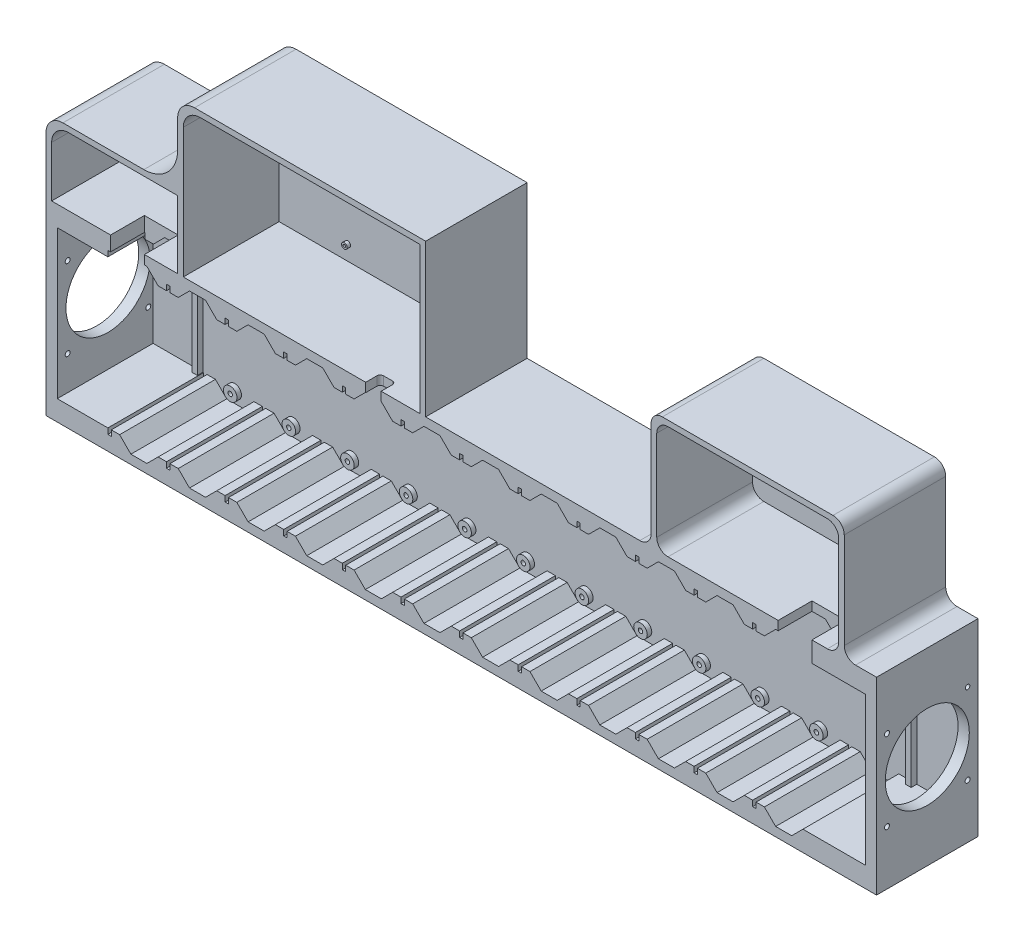
from build123d import *

# Parameters (mm, degrees)
SZKIC1_R                       = 6
DODANIE_WYCI_GNI_CIE1_DEPTH    = 4
DODANIE_WYCI_GNI_CIE1_2_DEPTH  = 4
DODANIE_WYCI_GNI_CIE1_3_DEPTH  = 4
DODANIE_WYCI_GNI_CIE1_4_DEPTH  = 4
DODANIE_WYCI_GNI_CIE1_5_DEPTH  = 4
DODANIE_WYCI_GNI_CIE1_6_DEPTH  = 4
DODANIE_WYCI_GNI_CIE1_7_DEPTH  = 4
DODANIE_WYCI_GNI_CIE1_8_DEPTH  = 4
DODANIE_WYCI_GNI_CIE1_9_DEPTH  = 4
DODANIE_WYCI_GNI_CIE1_10_DEPTH = 4
DODANIE_WYCI_GNI_CIE1_11_DEPTH = 4
DODANIE_WYCI_GNI_CIE1_12_DEPTH = 4
DODANIE_WYCI_GNI_CIE1_13_DEPTH = 4
DODANIE_WYCI_GNI_CIE1_14_DEPTH = 4
DODANIE_WYCI_GNI_CIE1_15_DEPTH = 4
DODANIE_WYCI_GNI_CIE1_16_DEPTH = 4
DODANIE_WYCI_GNI_CIE1_17_DEPTH = 4
DODANIE_WYCI_GNI_CIE1_18_DEPTH = 4
DODANIE_WYCI_GNI_CIE1_19_DEPTH = 4
DODANIE_WYCI_GNI_CIE1_20_DEPTH = 4
DODANIE_WYCI_GNI_CIE1_21_DEPTH = 4
SZKIC1_R_2                     = 2
DODANIE_WYCI_GNI_CIE1_22_DEPTH = 4
DODANIE_WYCI_GNI_CIE1_23_DEPTH = 4
DODANIE_WYCI_GNI_CIE1_24_DEPTH = 4
DODANIE_WYCI_GNI_CIE2_START    = -5
SZKIC1_3_R                     = 6
DODANIE_WYCI_GNI_CIE2_DEPTH    = 5
DODANIE_WYCI_GNI_CIE3_START    = -5
SZKIC1_4_W                     = 736.8
SZKIC1_4_H                     = 167.4
DODANIE_WYCI_GNI_CIE3_DEPTH    = 90
SZKIC2_W                       = 736.8
SZKIC2_H                       = 167.4
DODANIE_WYCI_GNI_CIE4_DEPTH    = 5
WYTNIJ_WYCI_GNI_CIE1_START     = -4
SZKIC3_R                       = 2
WYTNIJ_WYCI_GNI_CIE1_DEPTH     = 4
SZKIC4_W                       = 45
SZKIC4_H                       = 131.4
WYTNIJ_WYCI_GNI_CIE2_DEPTH     = 85
SZKIC5_W                       = 5
SZKIC5_H                       = 131.4
DODANIE_WYCI_GNI_CIE5_DEPTH    = 5
SZKIC7_R                       = 2
SZKIC7_R_2                     = 2.2
SZKIC7_R_3                     = 37.294131406
WYTNIJ_WYCI_GNI_CIE5_DEPTH     = 15
WYTNIJ_WYCI_GNI_CIE7_START     = -700
SZKIC7_3_R                     = 2
SZKIC7_3_R_2                   = 2.2
SZKIC7_3_R_3                   = 37.294131406
WYTNIJ_WYCI_GNI_CIE7_DEPTH     = 5000
SZKIC8_W                       = 30
SZKIC8_H                       = 30
WYTNIJ_WYCI_GNI_CIE8_DEPTH     = 40
DODANIE_WYCI_GNI_CIE6_DEPTH    = 100
SZKIC11_W                      = 171.35
SZKIC11_H                      = 90
DODANIE_WYCI_GNI_CIE7_DEPTH    = 5
SZKIC10_R                      = 2.6543
DODANIE_WYCI_GNI_CIE8_DEPTH    = 5
ZAOKR_GLENIE1_R                = 10
DODANIE_WYCI_GNI_CIE9_DEPTH    = 130
SZKIC13_R                      = 2.5
SZKIC13_R_2                    = 1.1
DODANIE_WYCI_GNI_CIE10_DEPTH   = 3
SZKIC15_W                      = 3
SZKIC15_H                      = 5
WYTNIJ_WYCI_GNI_CIE9_DEPTH     = 85
SZKIC17_W                      = 13.772131981
SZKIC17_H                      = 12.917350147
WYTNIJ_WYCI_GNI_CIE11_DEPTH    = 10
ZAOKR_GLENIE4_R                = 3
DODANIE_WYCI_GNI_CIE12_DEPTH   = 60
SZKIC19_W                      = 116.8
SZKIC19_H                      = 90
DODANIE_WYCI_GNI_CIE14_DEPTH   = 5
ZAOKR_GLENIE5_R                = 15
ZAOKR_GLENIE6_R                = 30
SZKIC20_W                      = 220
SZKIC20_H                      = 90
DODANIE_WYCI_GNI_CIE15_DEPTH   = 5
ZAOKR_GLENIE8_R                = 15


with BuildPart() as part:
    # Szkic1 → Dodanie-wyciągnięcie1 (new body)
    with BuildSketch(Plane.XY):
        with Locations((-21.55, -67)):
            Circle(SZKIC1_R)
    extrude(amount=DODANIE_WYCI_GNI_CIE1_DEPTH)



with BuildPart() as body_2:
    # Szkic1 → Dodanie-wyci_gni_cie1 2 (new body)
    with BuildSketch(Plane.XY):
        with Locations((30.45, -67)):
            Circle(SZKIC1_R)
    extrude(amount=DODANIE_WYCI_GNI_CIE1_2_DEPTH)


with BuildPart() as body_3:
    # Szkic1 → Dodanie-wyci_gni_cie1 3 (new body)
    with BuildSketch(Plane.XY):
        with Locations((82.45, -67)):
            Circle(SZKIC1_R)
    extrude(amount=DODANIE_WYCI_GNI_CIE1_3_DEPTH)


with BuildPart() as body_4:
    # Szkic1 → Dodanie-wyci_gni_cie1 4 (new body)
    with BuildSketch(Plane.XY):
        with Locations((134.45, -67)):
            Circle(SZKIC1_R)
    extrude(amount=DODANIE_WYCI_GNI_CIE1_4_DEPTH)


with BuildPart() as body_5:
    # Szkic1 → Dodanie-wyci_gni_cie1 5 (new body)
    with BuildSketch(Plane.XY):
        with Locations((134.45, 67)):
            Circle(SZKIC1_R)
    extrude(amount=DODANIE_WYCI_GNI_CIE1_5_DEPTH)


with BuildPart() as body_6:
    # Szkic1 → Dodanie-wyci_gni_cie1 6 (new body)
    with BuildSketch(Plane.XY):
        with Locations((186.45, -67)):
            Circle(SZKIC1_R)
    extrude(amount=DODANIE_WYCI_GNI_CIE1_6_DEPTH)


with BuildPart() as body_7:
    # Szkic1 → Dodanie-wyci_gni_cie1 7 (new body)
    with BuildSketch(Plane.XY):
        with Locations((238.45, -67)):
            Circle(SZKIC1_R)
    extrude(amount=DODANIE_WYCI_GNI_CIE1_7_DEPTH)


with BuildPart() as body_8:
    # Szkic1 → Dodanie-wyci_gni_cie1 8 (new body)
    with BuildSketch(Plane.XY):
        with Locations((186.45, 67)):
            Circle(SZKIC1_R)
    extrude(amount=DODANIE_WYCI_GNI_CIE1_8_DEPTH)


with BuildPart() as body_9:
    # Szkic1 → Dodanie-wyci_gni_cie1 9 (new body)
    with BuildSketch(Plane.XY):
        with Locations((238.45, 67)):
            Circle(SZKIC1_R)
    extrude(amount=DODANIE_WYCI_GNI_CIE1_9_DEPTH)


with BuildPart() as body_10:
    # Szkic1 → Dodanie-wyci_gni_cie1 10 (new body)
    with BuildSketch(Plane.XY):
        with Locations((290.45, -67)):
            Circle(SZKIC1_R)
    extrude(amount=DODANIE_WYCI_GNI_CIE1_10_DEPTH)


with BuildPart() as body_11:
    # Szkic1 → Dodanie-wyci_gni_cie1 11 (new body)
    with BuildSketch(Plane.XY):
        with Locations((342.45, -67)):
            Circle(SZKIC1_R)
    extrude(amount=DODANIE_WYCI_GNI_CIE1_11_DEPTH)


with BuildPart() as body_12:
    # Szkic1 → Dodanie-wyci_gni_cie1 12 (new body)
    with BuildSketch(Plane.XY):
        with Locations((290.45, 67)):
            Circle(SZKIC1_R)
    extrude(amount=DODANIE_WYCI_GNI_CIE1_12_DEPTH)


with BuildPart() as body_13:
    # Szkic1 → Dodanie-wyci_gni_cie1 13 (new body)
    with BuildSketch(Plane.XY):
        with Locations((342.45, 67)):
            Circle(SZKIC1_R)
    extrude(amount=DODANIE_WYCI_GNI_CIE1_13_DEPTH)


with BuildPart() as body_14:
    # Szkic1 → Dodanie-wyci_gni_cie1 14 (new body)
    with BuildSketch(Plane.XY):
        with Locations((394.45, -67)):
            Circle(SZKIC1_R)
    extrude(amount=DODANIE_WYCI_GNI_CIE1_14_DEPTH)


with BuildPart() as body_15:
    # Szkic1 → Dodanie-wyci_gni_cie1 15 (new body)
    with BuildSketch(Plane.XY):
        with Locations((446.45, -67)):
            Circle(SZKIC1_R)
    extrude(amount=DODANIE_WYCI_GNI_CIE1_15_DEPTH)


with BuildPart() as body_16:
    # Szkic1 → Dodanie-wyci_gni_cie1 16 (new body)
    with BuildSketch(Plane.XY):
        with Locations((394.45, 67)):
            Circle(SZKIC1_R)
    extrude(amount=DODANIE_WYCI_GNI_CIE1_16_DEPTH)


with BuildPart() as body_17:
    # Szkic1 → Dodanie-wyci_gni_cie1 17 (new body)
    with BuildSketch(Plane.XY):
        with Locations((446.45, 67)):
            Circle(SZKIC1_R)
    extrude(amount=DODANIE_WYCI_GNI_CIE1_17_DEPTH)


with BuildPart() as body_18:
    # Szkic1 → Dodanie-wyci_gni_cie1 18 (new body)
    with BuildSketch(Plane.XY):
        with Locations((498.45, -67)):
            Circle(SZKIC1_R)
    extrude(amount=DODANIE_WYCI_GNI_CIE1_18_DEPTH)


with BuildPart() as body_19:
    # Szkic1 → Dodanie-wyci_gni_cie1 19 (new body)
    with BuildSketch(Plane.XY):
        with Locations((550.45, -67)):
            Circle(SZKIC1_R)
    extrude(amount=DODANIE_WYCI_GNI_CIE1_19_DEPTH)


with BuildPart() as body_20:
    # Szkic1 → Dodanie-wyci_gni_cie1 20 (new body)
    with BuildSketch(Plane.XY):
        with Locations((498.45, 67)):
            Circle(SZKIC1_R)
    extrude(amount=DODANIE_WYCI_GNI_CIE1_20_DEPTH)


with BuildPart() as body_21:
    # Szkic1 → Dodanie-wyci_gni_cie1 21 (new body)
    with BuildSketch(Plane.XY):
        with Locations((550.45, 67)):
            Circle(SZKIC1_R)
    extrude(amount=DODANIE_WYCI_GNI_CIE1_21_DEPTH)


with BuildPart() as body_22:
    # Szkic1 → Dodanie-wyci_gni_cie1 22 (new body)
    with BuildSketch(Plane.XY):
        with Locations((-21.55, 67)):
            Circle(SZKIC1_R)
        with Locations((-21.55, 67)):
            Circle(SZKIC1_R_2, mode=Mode.SUBTRACT)
    extrude(amount=DODANIE_WYCI_GNI_CIE1_22_DEPTH)


with BuildPart() as body_23:
    # Szkic1 → Dodanie-wyci_gni_cie1 23 (new body)
    with BuildSketch(Plane.XY):
        with Locations((30.45, 67)):
            Circle(SZKIC1_R)
        with Locations((30.45, 67)):
            Circle(SZKIC1_R_2, mode=Mode.SUBTRACT)
    extrude(amount=DODANIE_WYCI_GNI_CIE1_23_DEPTH)


with BuildPart() as body_24:
    # Szkic1 → Dodanie-wyci_gni_cie1 24 (new body)
    with BuildSketch(Plane.XY):
        with Locations((82.45, 67)):
            Circle(SZKIC1_R)
        with Locations((82.45, 67)):
            Circle(SZKIC1_R_2, mode=Mode.SUBTRACT)
    extrude(amount=DODANIE_WYCI_GNI_CIE1_24_DEPTH)


with BuildPart() as body_25:
    # Szkic1<3> → Dodanie-wyciągnięcie2 (new body)
    with BuildSketch(Plane.XY.offset(DODANIE_WYCI_GNI_CIE2_START)):
        Polygon((-38.65, 65), (-48.95, 65), (-48.95, -66.4), (-38.65, -66.4), (-28.65, -76.4), (-14.45, -76.4), (-4.45, -66.4), (13.35, -66.4), (23.35, -76.4), (37.55, -76.4), (47.55, -66.4), (65.35, -66.4), (75.35, -76.4), (89.55, -76.4), (99.55, -66.4), (117.35, -66.4), (127.35, -76.4), (141.55, -76.4), (151.55, -66.4), (169.35, -66.4), (179.35, -76.4), (193.55, -76.4), (203.55, -66.4), (221.35, -66.4), (231.35, -76.4), (245.55, -76.4), (255.55, -66.4), (273.35, -66.4), (283.35, -76.4), (297.55, -76.4), (307.55, -66.4), (325.35, -66.4), (335.35, -76.4), (349.55, -76.4), (359.55, -66.4), (377.35, -66.4), (387.35, -76.4), (401.55, -76.4), (411.55, -66.4), (429.35, -66.4), (439.35, -76.4), (453.55, -76.4), (463.55, -66.4), (481.35, -66.4), (491.35, -76.4), (505.55, -76.4), (515.55, -66.4), (533.35, -66.4), (543.35, -76.4), (557.55, -76.4), (567.55, -66.4), (577.85, -66.4), (577.85, 65), (567.55, 65), (557.55, 75), (543.35, 75), (533.35, 65), (515.55, 65), (505.55, 75), (491.35, 75), (481.35, 65), (463.55, 65), (453.55, 75), (439.35, 75), (429.35, 65), (411.55, 65), (401.55, 75), (387.35, 75), (377.35, 65), (359.55, 65), (349.55, 75), (335.35, 75), (325.35, 65), (307.55, 65), (297.55, 75), (283.35, 75), (273.35, 65), (255.55, 65), (245.55, 75), (231.35, 75), (221.35, 65), (203.55, 65), (193.55, 75), (179.35, 75), (169.35, 65), (151.55, 65), (141.55, 75), (127.35, 75), (117.35, 65), (99.55, 65), (89.55, 75), (75.35, 75), (65.35, 65), (47.55, 65), (37.55, 75), (23.35, 75), (13.35, 65), (-4.45, 65), (-14.45, 75), (-28.65, 75), align=None)
        with Locations((-21.55, -67)):
            Circle(SZKIC1_3_R, mode=Mode.SUBTRACT)
        with Locations((30.45, -67)):
            Circle(SZKIC1_3_R, mode=Mode.SUBTRACT)
        with Locations((82.45, -67)):
            Circle(SZKIC1_3_R, mode=Mode.SUBTRACT)
        with Locations((134.45, -67)):
            Circle(SZKIC1_3_R, mode=Mode.SUBTRACT)
        with Locations((186.45, -67)):
            Circle(SZKIC1_3_R, mode=Mode.SUBTRACT)
        with Locations((238.45, -67)):
            Circle(SZKIC1_3_R, mode=Mode.SUBTRACT)
        with Locations((290.45, -67)):
            Circle(SZKIC1_3_R, mode=Mode.SUBTRACT)
        with Locations((342.45, -67)):
            Circle(SZKIC1_3_R, mode=Mode.SUBTRACT)
        with Locations((394.45, -67)):
            Circle(SZKIC1_3_R, mode=Mode.SUBTRACT)
        with Locations((446.45, -67)):
            Circle(SZKIC1_3_R, mode=Mode.SUBTRACT)
        with Locations((498.45, -67)):
            Circle(SZKIC1_3_R, mode=Mode.SUBTRACT)
        with Locations((550.45, -67)):
            Circle(SZKIC1_3_R, mode=Mode.SUBTRACT)
        with Locations((-21.55, 67)):
            Circle(SZKIC1_3_R, mode=Mode.SUBTRACT)
        with Locations((30.45, 67)):
            Circle(SZKIC1_3_R, mode=Mode.SUBTRACT)
        with Locations((82.45, 67)):
            Circle(SZKIC1_3_R, mode=Mode.SUBTRACT)
        with Locations((134.45, 67)):
            Circle(SZKIC1_3_R, mode=Mode.SUBTRACT)
        with Locations((186.45, 67)):
            Circle(SZKIC1_3_R, mode=Mode.SUBTRACT)
        with Locations((238.45, 67)):
            Circle(SZKIC1_3_R, mode=Mode.SUBTRACT)
        with Locations((290.45, 67)):
            Circle(SZKIC1_3_R, mode=Mode.SUBTRACT)
        with Locations((342.45, 67)):
            Circle(SZKIC1_3_R, mode=Mode.SUBTRACT)
        with Locations((394.45, 67)):
            Circle(SZKIC1_3_R, mode=Mode.SUBTRACT)
        with Locations((446.45, 67)):
            Circle(SZKIC1_3_R, mode=Mode.SUBTRACT)
        with Locations((498.45, 67)):
            Circle(SZKIC1_3_R, mode=Mode.SUBTRACT)
        with Locations((550.45, 67)):
            Circle(SZKIC1_3_R, mode=Mode.SUBTRACT)
    extrude(amount=DODANIE_WYCI_GNI_CIE2_DEPTH)

    # Szkic1<4> → Dodanie-wyciągnięcie3 (add)
    with BuildSketch(Plane.XY.offset(DODANIE_WYCI_GNI_CIE3_START)):
        with Locations((264.45, -0.7)):
            Rectangle(SZKIC1_4_W, SZKIC1_4_H)
        Polygon((-48.95, -66.4), (-48.95, 65), (-38.65, 65), (-28.65, 75), (-14.45, 75), (-4.45, 65), (13.35, 65), (23.35, 75), (37.55, 75), (47.55, 65), (65.35, 65), (75.35, 75), (89.55, 75), (99.55, 65), (117.35, 65), (127.35, 75), (141.55, 75), (151.55, 65), (169.35, 65), (179.35, 75), (193.55, 75), (203.55, 65), (221.35, 65), (231.35, 75), (245.55, 75), (255.55, 65), (273.35, 65), (283.35, 75), (297.55, 75), (307.55, 65), (325.35, 65), (335.35, 75), (349.55, 75), (359.55, 65), (377.35, 65), (387.35, 75), (401.55, 75), (411.55, 65), (429.35, 65), (439.35, 75), (453.55, 75), (463.55, 65), (481.35, 65), (491.35, 75), (505.55, 75), (515.55, 65), (533.35, 65), (543.35, 75), (557.55, 75), (567.55, 65), (577.85, 65), (577.85, -66.4), (567.55, -66.4), (557.55, -76.4), (543.35, -76.4), (533.35, -66.4), (515.55, -66.4), (505.55, -76.4), (491.35, -76.4), (481.35, -66.4), (463.55, -66.4), (453.55, -76.4), (439.35, -76.4), (429.35, -66.4), (411.55, -66.4), (401.55, -76.4), (387.35, -76.4), (377.35, -66.4), (359.55, -66.4), (349.55, -76.4), (335.35, -76.4), (325.35, -66.4), (307.55, -66.4), (297.55, -76.4), (283.35, -76.4), (273.35, -66.4), (255.55, -66.4), (245.55, -76.4), (231.35, -76.4), (221.35, -66.4), (203.55, -66.4), (193.55, -76.4), (179.35, -76.4), (169.35, -66.4), (151.55, -66.4), (141.55, -76.4), (127.35, -76.4), (117.35, -66.4), (99.55, -66.4), (89.55, -76.4), (75.35, -76.4), (65.35, -66.4), (47.55, -66.4), (37.55, -76.4), (23.35, -76.4), (13.35, -66.4), (-4.45, -66.4), (-14.45, -76.4), (-28.65, -76.4), (-38.65, -66.4), align=None, mode=Mode.SUBTRACT)
    extrude(amount=DODANIE_WYCI_GNI_CIE3_DEPTH)


with BuildPart() as part_1:
    add(part.part)

    add(body_2.part)  # Dodanie-wyciągnięcie4 merges body 2

    add(body_3.part)  # Dodanie-wyciągnięcie4 merges body 3

    add(body_4.part)  # Dodanie-wyciągnięcie4 merges body 4

    add(body_5.part)  # Dodanie-wyciągnięcie4 merges body 5

    add(body_6.part)  # Dodanie-wyciągnięcie4 merges body 6

    add(body_7.part)  # Dodanie-wyciągnięcie4 merges body 7

    add(body_8.part)  # Dodanie-wyciągnięcie4 merges body 8

    add(body_9.part)  # Dodanie-wyciągnięcie4 merges body 9

    add(body_10.part)  # Dodanie-wyciągnięcie4 merges body 10

    add(body_11.part)  # Dodanie-wyciągnięcie4 merges body 11

    add(body_12.part)  # Dodanie-wyciągnięcie4 merges body 12

    add(body_13.part)  # Dodanie-wyciągnięcie4 merges body 13

    add(body_14.part)  # Dodanie-wyciągnięcie4 merges body 14

    add(body_15.part)  # Dodanie-wyciągnięcie4 merges body 15

    add(body_16.part)  # Dodanie-wyciągnięcie4 merges body 16

    add(body_17.part)  # Dodanie-wyciągnięcie4 merges body 17

    add(body_18.part)  # Dodanie-wyciągnięcie4 merges body 18

    add(body_19.part)  # Dodanie-wyciągnięcie4 merges body 19

    add(body_20.part)  # Dodanie-wyciągnięcie4 merges body 20

    add(body_21.part)  # Dodanie-wyciągnięcie4 merges body 21

    add(body_22.part)  # Dodanie-wyciągnięcie4 merges body 22

    add(body_23.part)  # Dodanie-wyciągnięcie4 merges body 23

    add(body_24.part)  # Dodanie-wyciągnięcie4 merges body 24

    add(body_25.part)  # Dodanie-wyciągnięcie4 merges body 25
    # Szkic2 → Dodanie-wyciągnięcie4 (add)
    with BuildSketch(Plane(origin=(0, 0, -5), x_dir=(-1, 0, 0), z_dir=(0, 0, -1))):
        with Locations((-264.45, -0.7)):
            Rectangle(SZKIC2_W, SZKIC2_H)
    extrude(amount=-DODANIE_WYCI_GNI_CIE4_DEPTH)

    # Szkic3 → Wytnij-wyciągnięcie1 (cut)
    with BuildSketch(Plane.XY.offset(4).offset(WYTNIJ_WYCI_GNI_CIE1_START)):
        with Locations((550.45, -67)):
            Circle(SZKIC3_R)
        with Locations((550.45, 67)):
            Circle(SZKIC3_R)
        with Locations((498.45, 67)):
            Circle(SZKIC3_R)
        with Locations((498.45, -67)):
            Circle(SZKIC3_R)
        with Locations((446.45, 67)):
            Circle(SZKIC3_R)
        with Locations((446.45, -67)):
            Circle(SZKIC3_R)
        with Locations((394.45, 67)):
            Circle(SZKIC3_R)
        with Locations((394.45, -67)):
            Circle(SZKIC3_R)
        with Locations((342.45, 67)):
            Circle(SZKIC3_R)
        with Locations((342.45, -67)):
            Circle(SZKIC3_R)
        with Locations((290.45, 67)):
            Circle(SZKIC3_R)
        with Locations((290.45, -67)):
            Circle(SZKIC3_R)
        with Locations((238.45, 67)):
            Circle(SZKIC3_R)
        with Locations((238.45, -67)):
            Circle(SZKIC3_R)
        with Locations((186.45, 67)):
            Circle(SZKIC3_R)
        with Locations((186.45, -67)):
            Circle(SZKIC3_R)
        with Locations((134.45, 67)):
            Circle(SZKIC3_R)
        with Locations((134.45, -67)):
            Circle(SZKIC3_R)
        with Locations((82.45, 67)):
            Circle(SZKIC3_R)
        with Locations((82.45, -67)):
            Circle(SZKIC3_R)
        with Locations((30.45, 67)):
            Circle(SZKIC3_R)
        with Locations((30.45, -67)):
            Circle(SZKIC3_R)
        with Locations((-21.55, 67)):
            Circle(SZKIC3_R)
        with Locations((-21.55, -67)):
            Circle(SZKIC3_R)
    extrude(amount=WYTNIJ_WYCI_GNI_CIE1_DEPTH, mode=Mode.SUBTRACT)

    # Szkic4 → Wytnij-wyciągnięcie2 (cut)
    with BuildSketch(Plane.XY.offset(85)):
        with Locations((-71.45, -0.7)):
            Rectangle(SZKIC4_W, SZKIC4_H)
        with Locations((600.35, -0.7)):
            Rectangle(SZKIC4_W, SZKIC4_H)
    extrude(amount=-WYTNIJ_WYCI_GNI_CIE2_DEPTH, mode=Mode.SUBTRACT)

    # Szkic5 → Dodanie-wyciągnięcie5 (add)
    with BuildSketch(Plane.XY):
        with Locations((-52.15, -0.7)):
            Rectangle(SZKIC5_W, SZKIC5_H)
        with Locations((581.05, -0.7)):
            Rectangle(SZKIC5_W, SZKIC5_H)
    extrude(amount=DODANIE_WYCI_GNI_CIE5_DEPTH)

    # Szkic7 → Wytnij-wyciągnięcie5 (cut)
    with BuildSketch(Plane.ZY.offset(103.95)):
        with Locations((4.25, 35.05)):
            Circle(SZKIC7_R)
        with Locations((75.75, 35.05)):
            Circle(SZKIC7_R_2)
        with Locations((4.25, -36.45)):
            Circle(SZKIC7_R_2)
        with Locations((75.75, -36.45)):
            Circle(SZKIC7_R_2)
        with Locations((40, -0.7)):
            Circle(SZKIC7_R_3)
    extrude(amount=-WYTNIJ_WYCI_GNI_CIE5_DEPTH, mode=Mode.SUBTRACT)

    # Szkic7<3> → Wytnij-wyciągnięcie7 (cut)
    with BuildSketch(Plane.ZY.offset(103.95).offset(WYTNIJ_WYCI_GNI_CIE7_START)):
        with Locations((4.25, 35.05)):
            Circle(SZKIC7_3_R)
        with Locations((75.75, 35.05)):
            Circle(SZKIC7_3_R_2)
        with Locations((4.25, -36.45)):
            Circle(SZKIC7_3_R_2)
        with Locations((75.75, -36.45)):
            Circle(SZKIC7_3_R_2)
        with Locations((40, -0.7)):
            Circle(SZKIC7_3_R_3)
    extrude(amount=-WYTNIJ_WYCI_GNI_CIE7_DEPTH, mode=Mode.SUBTRACT)

    # Szkic8 → Wytnij-wyciągnięcie8 (cut)
    with BuildSketch(Plane(origin=(0, 83, 0), x_dir=(1, 0, 0), z_dir=(0, 1, 0))):
        with Locations((560.55, -70)):
            Rectangle(SZKIC8_W, SZKIC8_H)
        with Locations((-31.65, -70)):
            Rectangle(SZKIC8_W, SZKIC8_H)
    extrude(amount=-WYTNIJ_WYCI_GNI_CIE8_DEPTH, mode=Mode.SUBTRACT)

    # Szkic9 → Dodanie-wyciągnięcie6 (add)
    with BuildSketch(Plane(origin=(0, 83, 0), x_dir=(1, 0, 0), z_dir=(0, 1, 0))):
        Polygon((604.2, -85), (604.2, 5), (432.85, 5), (432.85, -85), (437.85, -85), (437.85, 0), (599.2, 0), (599.2, -85), align=None)
    extrude(amount=DODANIE_WYCI_GNI_CIE6_DEPTH)

    # Szkic11 → Dodanie-wyciągnięcie7 (add)
    with BuildSketch(Plane(origin=(0, 183, 0), x_dir=(1, 0, 0), z_dir=(0, 1, 0))):
        with Locations((518.525, -40)):
            Rectangle(SZKIC11_W, SZKIC11_H)
    extrude(amount=DODANIE_WYCI_GNI_CIE7_DEPTH)

    # Szkic10 → Dodanie-wyciągnięcie8 (add)
    with BuildSketch(Plane.XY):
        Polygon((544.2, 104.810882366), (544.2, 110.964050872), (544.2, 161.129050872), (488.32, 161.129050872), (488.32, 115.775688187), (488.32, 105.249050872), (501.171568658, 105.249050872), (526.786565716, 104.810882366), align=None)
        with Locations((538.42427472, 110.964050872)):
            Circle(SZKIC10_R, mode=Mode.SUBTRACT)
        with Locations((493.97427472, 155.414050872)):
            Circle(SZKIC10_R, mode=Mode.SUBTRACT)
    extrude(amount=DODANIE_WYCI_GNI_CIE8_DEPTH)

    # Zaokrąglenie1
    zaokr_glenie1_edges = [part_1.edges().sort_by_distance(p)[0] for p in [
        (599.2, 183, 42.5),
        (604.2, 83, 40),
        (432.85, 83, 40),
        (432.85, 188, 40),
        (604.2, 188, 40),
        (437.85, 183, 42.5),
        (437.85, 83, 42.5),
        (599.2, 83, 42.5),
    ]]
    fillet(zaokr_glenie1_edges, radius=ZAOKR_GLENIE1_R)

    # Szkic12 → Dodanie-wyciągnięcie9 (add)
    with BuildSketch(Plane(origin=(0, 83, 0), x_dir=(1, 0, 0), z_dir=(0, 1, 0))):
        Polygon((12.85, 0), (12.85, -85), (17.85, -85), (17.85, 0), (227.85, 0), (227.85, -85), (232.85, -85), (232.85, 5), (12.85, 5), align=None)
    extrude(amount=DODANIE_WYCI_GNI_CIE9_DEPTH)

    # Szkic13 → Dodanie-wyciągnięcie10 (add)
    # profile 1 of 4: a face of its own
    with BuildSketch(Plane.XY):
        with Locations((220.757959754, 96.345353137)):
            Circle(SZKIC13_R)
        with Locations((220.757959754, 96.345353137)):
            Circle(SZKIC13_R_2, mode=Mode.SUBTRACT)
    # profile 2 of 4: a face of its own
    with BuildSketch(Plane.XY):
        with Locations((220.757959754, 145.845353137)):
            Circle(SZKIC13_R)
        with Locations((220.757959754, 145.845353137)):
            Circle(SZKIC13_R_2, mode=Mode.SUBTRACT)
    # profile 3 of 4: a face of its own
    with BuildSketch(Plane.XY):
        with Locations((78.757959754, 164.345353137)):
            Circle(SZKIC13_R)
        with Locations((78.757959754, 164.345353137)):
            Circle(SZKIC13_R_2, mode=Mode.SUBTRACT)
    # profile 4 of 4: a face of its own
    with BuildSketch(Plane.XY):
        with Locations((78.757959754, 96.345353137)):
            Circle(SZKIC13_R)
        with Locations((78.757959754, 96.345353137)):
            Circle(SZKIC13_R_2, mode=Mode.SUBTRACT)
    extrude(amount=DODANIE_WYCI_GNI_CIE10_DEPTH)

    # Szkic15 → Wytnij-wyciągnięcie9 (cut)
    with BuildSketch(Plane.XY.offset(85)):
        with Locations((524.45, 67.5)):
            Rectangle(SZKIC15_W, SZKIC15_H)
        with Locations((472.45, 67.5)):
            Rectangle(SZKIC15_W, SZKIC15_H)
        with Locations((420.45, 67.5)):
            Rectangle(SZKIC15_W, SZKIC15_H)
        with Locations((368.45, 67.5)):
            Rectangle(SZKIC15_W, SZKIC15_H)
        with Locations((316.45, 67.5)):
            Rectangle(SZKIC15_W, SZKIC15_H)
        with Locations((264.45, 67.5)):
            Rectangle(SZKIC15_W, SZKIC15_H)
        with Locations((212.45, 67.5)):
            Rectangle(SZKIC15_W, SZKIC15_H)
        with Locations((160.45, 67.5)):
            Rectangle(SZKIC15_W, SZKIC15_H)
        with Locations((108.45, 67.5)):
            Rectangle(SZKIC15_W, SZKIC15_H)
        with Locations((56.45, 67.5)):
            Rectangle(SZKIC15_W, SZKIC15_H)
        with Locations((4.45, 67.5)):
            Rectangle(SZKIC15_W, SZKIC15_H)
        with Locations((-47.55, 67.5)):
            Rectangle(SZKIC15_W, SZKIC15_H)
        with Locations((-47.55, -68.9)):
            Rectangle(SZKIC15_W, SZKIC15_H)
        with Locations((4.45, -68.9)):
            Rectangle(SZKIC15_W, SZKIC15_H)
        with Locations((56.45, -68.9)):
            Rectangle(SZKIC15_W, SZKIC15_H)
        with Locations((108.45, -68.9)):
            Rectangle(SZKIC15_W, SZKIC15_H)
        with Locations((160.45, -68.9)):
            Rectangle(SZKIC15_W, SZKIC15_H)
        with Locations((212.45, -68.9)):
            Rectangle(SZKIC15_W, SZKIC15_H)
        with Locations((264.45, -68.9)):
            Rectangle(SZKIC15_W, SZKIC15_H)
        with Locations((316.45, -68.9)):
            Rectangle(SZKIC15_W, SZKIC15_H)
        with Locations((368.45, -68.9)):
            Rectangle(SZKIC15_W, SZKIC15_H)
        with Locations((420.45, -68.9)):
            Rectangle(SZKIC15_W, SZKIC15_H)
        with Locations((472.45, -68.9)):
            Rectangle(SZKIC15_W, SZKIC15_H)
        with Locations((524.45, -68.9)):
            Rectangle(SZKIC15_W, SZKIC15_H)
    extrude(amount=-WYTNIJ_WYCI_GNI_CIE9_DEPTH, mode=Mode.SUBTRACT)

    # Szkic17 → Wytnij-wyciągnięcie11 (cut)
    with BuildSketch(Plane.XZ.offset(-75)):
        with Locations((186.520253508, 78.541324927)):
            Rectangle(SZKIC17_W, SZKIC17_H)
    extrude(amount=-WYTNIJ_WYCI_GNI_CIE11_DEPTH, mode=Mode.SUBTRACT)

    # Zaokrąglenie4
    zaokr_glenie4_edges = [part_1.edges().sort_by_distance(p)[0] for p in [
        (179.634187518, 79, 72.082649853),
        (193.406319499, 79, 72.082649853),
    ]]
    fillet(zaokr_glenie4_edges, radius=ZAOKR_GLENIE4_R)

    # Szkic12<3> → Dodanie-wyciągnięcie12 (add)
    with BuildSketch(Plane(origin=(0, 83, 0), x_dir=(1, 0, 0), z_dir=(0, 1, 0))):
        Polygon((-98.95, 0), (12.85, 0), (12.85, 5), (-103.95, 5), (-103.95, -85), (-98.95, -85), align=None)
    extrude(amount=DODANIE_WYCI_GNI_CIE12_DEPTH)

    # Szkic19 → Dodanie-wyciągnięcie14 (add)
    with BuildSketch(Plane(origin=(0, 143, 0), x_dir=(1, 0, 0), z_dir=(0, 1, 0))):
        with Locations((-45.55, -40)):
            Rectangle(SZKIC19_W, SZKIC19_H)
    extrude(amount=DODANIE_WYCI_GNI_CIE14_DEPTH)

    # Zaokrąglenie5
    zaokr_glenie5_edges = [part_1.edges().sort_by_distance(p)[0] for p in [
        (-98.95, 143, 42.5),
        (-103.95, 148, 40),
    ]]
    fillet(zaokr_glenie5_edges, radius=ZAOKR_GLENIE5_R)

    # Zaokrąglenie6
    zaokr_glenie6_edges = [part_1.edges().sort_by_distance(p)[0] for p in [
        (12.85, 148, 40),
    ]]
    fillet(zaokr_glenie6_edges, radius=ZAOKR_GLENIE6_R)

    # Szkic20 → Dodanie-wyciągnięcie15 (add)
    with BuildSketch(Plane(origin=(0, 213, 0), x_dir=(1, 0, 0), z_dir=(0, 1, 0))):
        with Locations((122.85, -40)):
            Rectangle(SZKIC20_W, SZKIC20_H)
    extrude(amount=DODANIE_WYCI_GNI_CIE15_DEPTH)

    # Zaokrąglenie8
    zaokr_glenie8_edges = [part_1.edges().sort_by_distance(p)[0] for p in [
        (17.85, 213, 42.5),
        (12.85, 218, 40),
    ]]
    fillet(zaokr_glenie8_edges, radius=ZAOKR_GLENIE8_R)


solid = part_1.part
